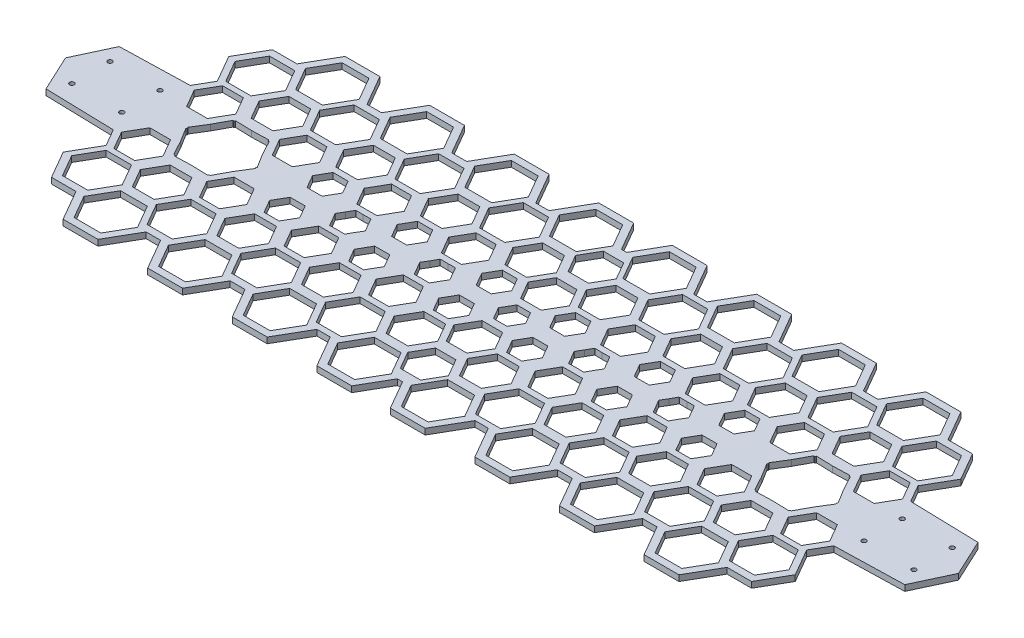
from build123d import *

# Parameters (mm, degrees)
SKETCH2_W                    = 965.2
SKETCH2_H                    = 304.8
BOSS_EXTRUDE1_DEPTH          = 6.35
CUT_EXTRUDE3_DEPTH           = 507.13125027
CUT_EXTRUDE4_DEPTH           = 507.13125027
CUT_EXTRUDE5_DEPTH           = 507.13125027
MIRROR11_COPY_1_DEPTH        = 507.13125027
MIRROR11_COPY_2_DEPTH        = 507.13125027
MIRROR11_COPY_3_DEPTH        = 507.13125027
MIRROR11_COPY_4_DEPTH        = 507.13125027
F_10_0_1935_DIAMETER_HOLE2_D = 4.9149


with BuildPart() as part:
    # Sketch2 → Boss-Extrude1 (new body)
    with BuildSketch(Plane(origin=(0, 0, 0), x_dir=(1, 0, 0), z_dir=(0, 1, 0))):
        Rectangle(SKETCH2_W, SKETCH2_H)
    extrude(amount=BOSS_EXTRUDE1_DEPTH)

    # Sketch7 → Cut-Extrude3 (cut, through all)
    with BuildSketch(Plane(origin=(0, 6.35, 0), x_dir=(1, 0, 0), z_dir=(0, 1, 0))):
        Polygon((-31.557733394, 37.30423334), (-47.833152431, 37.30423334), (-55.970861949, 23.209306996), (-47.833152431, 9.114380653), (-31.557733394, 9.114380653), (-23.420023875, 23.209306996), align=None)
        Polygon((-16.10013485, 64.205726722), (-27.897788881, 84.639862914), (-51.493096943, 84.639862914), (-63.290750974, 64.205726722), (-51.493096943, 43.77159053), (-27.897788881, 43.77159053), align=None)
        Polygon((-10.698063798, 119.777667092), (-25.196753355, 144.890134049), (-54.19413247, 144.890134049), (-68.692822027, 119.777667092), (-54.19413247, 94.665200136), (-25.196753355, 94.665200136), align=None)
        Polygon((-64.407710667, 39.328268759), (-75.230438627, 58.073783461), (-96.875894546, 58.073783461), (-107.698622506, 39.328268759), (-96.875894546, 20.582754056), (-75.230438627, 20.582754056), align=None)
        Polygon((-58.745423058, 88.260379231), (-72.399294822, 111.909578847), (-99.707038351, 111.909578847), (-113.360910116, 88.260379231), (-99.707038351, 64.611179615), (-72.399294822, 64.611179615), align=None)
        Polygon((-122.997733394, 37.30423334), (-139.273152431, 37.30423334), (-147.410861949, 23.209306996), (-139.273152431, 9.114380653), (-122.997733394, 9.114380653), (-114.860023875, 23.209306996), align=None)
        Polygon((-67.212185048, 0.237167397), (-75.528357755, 14.166866255), (-91.749917187, 13.929698858), (-99.655303911, -0.237167397), (-91.339131205, -14.166866255), (-75.117571773, -13.929698858), align=None)
        Polygon((-107.54013485, 64.205726722), (-119.337788881, 84.639862914), (-142.933096943, 84.639862914), (-154.730750974, 64.205726722), (-142.933096943, 43.77159053), (-119.337788881, 43.77159053), align=None)
        Polygon((-102.138063798, 119.777667092), (-116.636753355, 144.890134049), (-145.63413247, 144.890134049), (-160.132822027, 119.777667092), (-145.63413247, 94.665200136), (-116.636753355, 94.665200136), align=None)
        Polygon((-155.847710667, 39.328268759), (-166.670438627, 58.073783461), (-188.315894546, 58.073783461), (-199.138622506, 39.328268759), (-188.315894546, 20.582754056), (-166.670438627, 20.582754056), align=None)
        Polygon((-150.185423058, 88.260379231), (-163.839294822, 111.909578847), (-191.147038351, 111.909578847), (-204.800910116, 88.260379231), (-191.147038351, 64.611179615), (-163.839294822, 64.611179615), align=None)
        Polygon((-158.652185048, 0.237167397), (-166.968357755, 14.166866255), (-183.189917187, 13.929698858), (-191.095303911, -0.237167397), (-182.779131205, -14.166866255), (-166.557571773, -13.929698858), align=None)
        Polygon((-214.437733394, 37.30423334), (-230.713152431, 37.30423334), (-238.850861949, 23.209306996), (-230.713152431, 9.114380653), (-214.437733394, 9.114380653), (-206.300023875, 23.209306996), align=None)
        Polygon((-198.98013485, 64.205726722), (-210.777788881, 84.639862914), (-234.373096943, 84.639862914), (-246.170750974, 64.205726722), (-234.373096943, 43.77159053), (-210.777788881, 43.77159053), align=None)
        Polygon((-193.578063797, 119.777667092), (-208.076753355, 144.890134049), (-237.074132469, 144.890134049), (-251.572822027, 119.777667092), (-237.074132469, 94.665200136), (-208.076753355, 94.665200136), align=None)
        Polygon((-247.287710667, 39.328268759), (-258.110438627, 58.073783461), (-279.755894546, 58.073783461), (-290.578622506, 39.328268759), (-279.755894546, 20.582754056), (-258.110438627, 20.582754056), align=None)
        Polygon((-241.625423058, 88.260379231), (-255.279294822, 111.909578847), (-282.587038351, 111.909578847), (-296.240910116, 88.260379231), (-282.587038351, 64.611179615), (-255.279294822, 64.611179615), align=None)
        Polygon((-290.42013485, 64.205726722), (-302.217788881, 84.639862914), (-325.813096943, 84.639862914), (-337.610750974, 64.205726722), (-325.813096943, 43.77159053), (-302.217788881, 43.77159053), align=None)
        Polygon((-285.018063797, 119.777667092), (-299.516753355, 144.890134049), (-328.514132469, 144.890134049), (-343.012822027, 119.777667092), (-328.514132469, 94.665200136), (-299.516753355, 94.665200136), align=None)
        Polygon((-333.065423058, 88.260379231), (-346.719294822, 111.909578847), (-374.027038351, 111.909578847), (-387.680910115, 88.260379231), (-374.027038351, 64.611179615), (-346.719294822, 64.611179615), align=None)
        Polygon((-296.240910116, 33.030081091), (-333.733065828, 31.908237488), (-351.507598624, -1.121843603), (-331.789975709, -33.030081091), (-294.297819997, -31.908237488), (-276.5232872, 1.121843603), align=None)
        Polygon((-337.92047672, 39.328268759), (-349.146821653, 58.772868567), (-371.59951152, 58.772868567), (-382.825856454, 39.328268759), (-371.59951152, 19.883668951), (-349.146821653, 19.883668951), align=None)
    cut_extrude3 = extrude(amount=-CUT_EXTRUDE3_DEPTH, mode=Mode.SUBTRACT)

    # Sketch8 → Cut-Extrude4 (cut, through all)
    with BuildSketch(Plane(origin=(0, 6.35, 0), x_dir=(1, 0, 0), z_dir=(0, 1, 0))):
        Polygon((10.994488416, 109.737813004), (-10.994488416, 109.737813004), (-21.988976832, 90.694800464), (-10.994488416, 71.651787924), (10.994488416, 71.651787924), (21.988976832, 90.694800464), align=None)
        Polygon((10.728851511, 59.450017641), (-11.556453484, 59.450017641), (-22.699105982, 40.150377383), (-11.556453484, 20.850737126), (10.728851511, 20.850737126), (21.871504009, 40.150377383), align=None)
        Polygon((7.342001122, 12.716718973), (-7.342001122, 12.716718973), (-14.684002245, 0), (-7.342001122, -12.716718973), (7.342001122, -12.716718973), (14.684002245, 0), align=None)
    cut_extrude4 = extrude(amount=-CUT_EXTRUDE4_DEPTH, mode=Mode.SUBTRACT)

    # Sketch3 → Cut-Extrude5 (cut, through all)
    with BuildSketch(Plane(origin=(0, 6.35, 0), x_dir=(1, 0, 0), z_dir=(0, 1, 0))):
        Polygon((-482.6, 0), (-464.142167298, 39.582949968), (-389.400254125, 41.562639655), (-378.695532412, 60.103761542), (-395.652159794, 89.473501691), (-378.36286148, 119.419444799), (-351.891288022, 119.419444799), (-332.849955598, 152.4), (-295.180930226, 152.4), (-276.139597803, 119.419444799), (-260.451288022, 119.419444799), (-241.409955598, 152.4), (-203.740930226, 152.4), (-184.90641754, 119.777667092), (-168.804468284, 119.777667092), (-149.969955598, 152.4), (-112.300930226, 152.4), (-92.579101272, 118.240790232), (-78.251784553, 118.240790232), (-58.529955598, 152.4), (-20.860930226, 152.4), (-2.823570321, 121.158376209), (0, 121.158376209), (0, 240.353310545), (-11.734407676, 240.353310545), (-689.383609758, 240.353310545), (-689.383609758, 0), align=None)
    cut_extrude5 = extrude(amount=-CUT_EXTRUDE5_DEPTH, mode=Mode.SUBTRACT)

    # Mirror10: Cut-Extrude3, Cut-Extrude5 across plane
    add(cut_extrude3.mirror(Plane(origin=(0, 0, 0), x_dir=(0, 0, 1), z_dir=(1, 0, 0))), mode=Mode.SUBTRACT)
    add(cut_extrude5.mirror(Plane(origin=(0, 0, 0), x_dir=(0, 0, 1), z_dir=(1, 0, 0))), mode=Mode.SUBTRACT)

    # Mirror11: Cut-Extrude4 across plane
    add(cut_extrude4.mirror(Plane.XY), mode=Mode.SUBTRACT)

    # Mirror11 copy 1 sketch → Mirror11 copy 1 (cut, through all)
    with BuildSketch(Plane(origin=(0, 6.35, 0), x_dir=(-1, 0, 0), z_dir=(0, 1, 0))):
        Polygon((-31.557733394, 37.30423334), (-47.833152431, 37.30423334), (-55.970861949, 23.209306996), (-47.833152431, 9.114380653), (-31.557733394, 9.114380653), (-23.420023875, 23.209306996), align=None)
        Polygon((-16.10013485, 64.205726722), (-27.897788881, 84.639862914), (-51.493096943, 84.639862914), (-63.290750974, 64.205726722), (-51.493096943, 43.77159053), (-27.897788881, 43.77159053), align=None)
        Polygon((-10.698063798, 119.777667092), (-25.196753355, 144.890134049), (-54.19413247, 144.890134049), (-68.692822027, 119.777667092), (-54.19413247, 94.665200136), (-25.196753355, 94.665200136), align=None)
        Polygon((-64.407710667, 39.328268759), (-75.230438627, 58.073783461), (-96.875894546, 58.073783461), (-107.698622506, 39.328268759), (-96.875894546, 20.582754056), (-75.230438627, 20.582754056), align=None)
        Polygon((-58.745423058, 88.260379231), (-72.399294822, 111.909578847), (-99.707038351, 111.909578847), (-113.360910116, 88.260379231), (-99.707038351, 64.611179615), (-72.399294822, 64.611179615), align=None)
        Polygon((-122.997733394, 37.30423334), (-139.273152431, 37.30423334), (-147.410861949, 23.209306996), (-139.273152431, 9.114380653), (-122.997733394, 9.114380653), (-114.860023875, 23.209306996), align=None)
        Polygon((-67.212185048, 0.237167397), (-75.528357755, 14.166866255), (-91.749917187, 13.929698858), (-99.655303911, -0.237167397), (-91.339131205, -14.166866255), (-75.117571773, -13.929698858), align=None)
        Polygon((-107.54013485, 64.205726722), (-119.337788881, 84.639862914), (-142.933096943, 84.639862914), (-154.730750974, 64.205726722), (-142.933096943, 43.77159053), (-119.337788881, 43.77159053), align=None)
        Polygon((-102.138063798, 119.777667092), (-116.636753355, 144.890134049), (-145.63413247, 144.890134049), (-160.132822027, 119.777667092), (-145.63413247, 94.665200136), (-116.636753355, 94.665200136), align=None)
        Polygon((-155.847710667, 39.328268759), (-166.670438627, 58.073783461), (-188.315894546, 58.073783461), (-199.138622506, 39.328268759), (-188.315894546, 20.582754056), (-166.670438627, 20.582754056), align=None)
        Polygon((-150.185423058, 88.260379231), (-163.839294822, 111.909578847), (-191.147038351, 111.909578847), (-204.800910116, 88.260379231), (-191.147038351, 64.611179615), (-163.839294822, 64.611179615), align=None)
        Polygon((-158.652185048, 0.237167397), (-166.968357755, 14.166866255), (-183.189917187, 13.929698858), (-191.095303911, -0.237167397), (-182.779131205, -14.166866255), (-166.557571773, -13.929698858), align=None)
        Polygon((-214.437733394, 37.30423334), (-230.713152431, 37.30423334), (-238.850861949, 23.209306996), (-230.713152431, 9.114380653), (-214.437733394, 9.114380653), (-206.300023875, 23.209306996), align=None)
        Polygon((-198.98013485, 64.205726722), (-210.777788881, 84.639862914), (-234.373096943, 84.639862914), (-246.170750974, 64.205726722), (-234.373096943, 43.77159053), (-210.777788881, 43.77159053), align=None)
        Polygon((-193.578063797, 119.777667092), (-208.076753355, 144.890134049), (-237.074132469, 144.890134049), (-251.572822027, 119.777667092), (-237.074132469, 94.665200136), (-208.076753355, 94.665200136), align=None)
        Polygon((-247.287710667, 39.328268759), (-258.110438627, 58.073783461), (-279.755894546, 58.073783461), (-290.578622506, 39.328268759), (-279.755894546, 20.582754056), (-258.110438627, 20.582754056), align=None)
        Polygon((-241.625423058, 88.260379231), (-255.279294822, 111.909578847), (-282.587038351, 111.909578847), (-296.240910116, 88.260379231), (-282.587038351, 64.611179615), (-255.279294822, 64.611179615), align=None)
        Polygon((-290.42013485, 64.205726722), (-302.217788881, 84.639862914), (-325.813096943, 84.639862914), (-337.610750974, 64.205726722), (-325.813096943, 43.77159053), (-302.217788881, 43.77159053), align=None)
        Polygon((-285.018063797, 119.777667092), (-299.516753355, 144.890134049), (-328.514132469, 144.890134049), (-343.012822027, 119.777667092), (-328.514132469, 94.665200136), (-299.516753355, 94.665200136), align=None)
        Polygon((-333.065423058, 88.260379231), (-346.719294822, 111.909578847), (-374.027038351, 111.909578847), (-387.680910115, 88.260379231), (-374.027038351, 64.611179615), (-346.719294822, 64.611179615), align=None)
        Polygon((-296.240910116, 33.030081091), (-333.733065828, 31.908237488), (-351.507598624, -1.121843603), (-331.789975709, -33.030081091), (-294.297819997, -31.908237488), (-276.5232872, 1.121843603), align=None)
        Polygon((-337.92047672, 39.328268759), (-349.146821653, 58.772868567), (-371.59951152, 58.772868567), (-382.825856454, 39.328268759), (-371.59951152, 19.883668951), (-349.146821653, 19.883668951), align=None)
    extrude(amount=-MIRROR11_COPY_1_DEPTH, mode=Mode.SUBTRACT)

    # Mirror11 copy 2 sketch → Mirror11 copy 2 (cut, through all)
    with BuildSketch(Plane(origin=(0, 6.35, 0), x_dir=(-1, 0, 0), z_dir=(0, 1, 0))):
        Polygon((-482.6, 0), (-464.142167298, 39.582949968), (-389.400254125, 41.562639655), (-378.695532412, 60.103761542), (-395.652159794, 89.473501691), (-378.36286148, 119.419444799), (-351.891288022, 119.419444799), (-332.849955598, 152.4), (-295.180930226, 152.4), (-276.139597803, 119.419444799), (-260.451288022, 119.419444799), (-241.409955598, 152.4), (-203.740930226, 152.4), (-184.90641754, 119.777667092), (-168.804468284, 119.777667092), (-149.969955598, 152.4), (-112.300930226, 152.4), (-92.579101272, 118.240790232), (-78.251784553, 118.240790232), (-58.529955598, 152.4), (-20.860930226, 152.4), (-2.823570321, 121.158376209), (0, 121.158376209), (0, 240.353310545), (-11.734407676, 240.353310545), (-689.383609758, 240.353310545), (-689.383609758, 0), align=None)
    extrude(amount=-MIRROR11_COPY_2_DEPTH, mode=Mode.SUBTRACT)

    # Mirror11 copy 3 sketch → Mirror11 copy 3 (cut, through all)
    with BuildSketch(Plane(origin=(0, 6.35, 0), x_dir=(1, 0, 0), z_dir=(0, 1, 0))):
        Polygon((-31.557733394, -37.30423334), (-47.833152431, -37.30423334), (-55.970861949, -23.209306996), (-47.833152431, -9.114380653), (-31.557733394, -9.114380653), (-23.420023875, -23.209306996), align=None)
        Polygon((-16.10013485, -64.205726722), (-27.897788881, -84.639862914), (-51.493096943, -84.639862914), (-63.290750974, -64.205726722), (-51.493096943, -43.77159053), (-27.897788881, -43.77159053), align=None)
        Polygon((-10.698063798, -119.777667092), (-25.196753355, -144.890134049), (-54.19413247, -144.890134049), (-68.692822027, -119.777667092), (-54.19413247, -94.665200136), (-25.196753355, -94.665200136), align=None)
        Polygon((-64.407710667, -39.328268759), (-75.230438627, -58.073783461), (-96.875894546, -58.073783461), (-107.698622506, -39.328268759), (-96.875894546, -20.582754056), (-75.230438627, -20.582754056), align=None)
        Polygon((-58.745423058, -88.260379231), (-72.399294822, -111.909578847), (-99.707038351, -111.909578847), (-113.360910116, -88.260379231), (-99.707038351, -64.611179615), (-72.399294822, -64.611179615), align=None)
        Polygon((-122.997733394, -37.30423334), (-139.273152431, -37.30423334), (-147.410861949, -23.209306996), (-139.273152431, -9.114380653), (-122.997733394, -9.114380653), (-114.860023875, -23.209306996), align=None)
        Polygon((-67.212185048, -0.237167397), (-75.528357755, -14.166866255), (-91.749917187, -13.929698858), (-99.655303911, 0.237167397), (-91.339131205, 14.166866255), (-75.117571773, 13.929698858), align=None)
        Polygon((-107.54013485, -64.205726722), (-119.337788881, -84.639862914), (-142.933096943, -84.639862914), (-154.730750974, -64.205726722), (-142.933096943, -43.77159053), (-119.337788881, -43.77159053), align=None)
        Polygon((-102.138063798, -119.777667092), (-116.636753355, -144.890134049), (-145.63413247, -144.890134049), (-160.132822027, -119.777667092), (-145.63413247, -94.665200136), (-116.636753355, -94.665200136), align=None)
        Polygon((-155.847710667, -39.328268759), (-166.670438627, -58.073783461), (-188.315894546, -58.073783461), (-199.138622506, -39.328268759), (-188.315894546, -20.582754056), (-166.670438627, -20.582754056), align=None)
        Polygon((-150.185423058, -88.260379231), (-163.839294822, -111.909578847), (-191.147038351, -111.909578847), (-204.800910116, -88.260379231), (-191.147038351, -64.611179615), (-163.839294822, -64.611179615), align=None)
        Polygon((-158.652185048, -0.237167397), (-166.968357755, -14.166866255), (-183.189917187, -13.929698858), (-191.095303911, 0.237167397), (-182.779131205, 14.166866255), (-166.557571773, 13.929698858), align=None)
        Polygon((-214.437733394, -37.30423334), (-230.713152431, -37.30423334), (-238.850861949, -23.209306996), (-230.713152431, -9.114380653), (-214.437733394, -9.114380653), (-206.300023875, -23.209306996), align=None)
        Polygon((-198.98013485, -64.205726722), (-210.777788881, -84.639862914), (-234.373096943, -84.639862914), (-246.170750974, -64.205726722), (-234.373096943, -43.77159053), (-210.777788881, -43.77159053), align=None)
        Polygon((-193.578063797, -119.777667092), (-208.076753355, -144.890134049), (-237.074132469, -144.890134049), (-251.572822027, -119.777667092), (-237.074132469, -94.665200136), (-208.076753355, -94.665200136), align=None)
        Polygon((-247.287710667, -39.328268759), (-258.110438627, -58.073783461), (-279.755894546, -58.073783461), (-290.578622506, -39.328268759), (-279.755894546, -20.582754056), (-258.110438627, -20.582754056), align=None)
        Polygon((-241.625423058, -88.260379231), (-255.279294822, -111.909578847), (-282.587038351, -111.909578847), (-296.240910116, -88.260379231), (-282.587038351, -64.611179615), (-255.279294822, -64.611179615), align=None)
        Polygon((-290.42013485, -64.205726722), (-302.217788881, -84.639862914), (-325.813096943, -84.639862914), (-337.610750974, -64.205726722), (-325.813096943, -43.77159053), (-302.217788881, -43.77159053), align=None)
        Polygon((-285.018063797, -119.777667092), (-299.516753355, -144.890134049), (-328.514132469, -144.890134049), (-343.012822027, -119.777667092), (-328.514132469, -94.665200136), (-299.516753355, -94.665200136), align=None)
        Polygon((-333.065423058, -88.260379231), (-346.719294822, -111.909578847), (-374.027038351, -111.909578847), (-387.680910115, -88.260379231), (-374.027038351, -64.611179615), (-346.719294822, -64.611179615), align=None)
        Polygon((-296.240910116, -33.030081091), (-333.733065828, -31.908237488), (-351.507598624, 1.121843603), (-331.789975709, 33.030081091), (-294.297819997, 31.908237488), (-276.5232872, -1.121843603), align=None)
        Polygon((-337.92047672, -39.328268759), (-349.146821653, -58.772868567), (-371.59951152, -58.772868567), (-382.825856454, -39.328268759), (-371.59951152, -19.883668951), (-349.146821653, -19.883668951), align=None)
    extrude(amount=-MIRROR11_COPY_3_DEPTH, mode=Mode.SUBTRACT)

    # Mirror11 copy 4 sketch → Mirror11 copy 4 (cut, through all)
    with BuildSketch(Plane(origin=(0, 6.35, 0), x_dir=(1, 0, 0), z_dir=(0, 1, 0))):
        Polygon((-482.6, 0), (-464.142167298, -39.582949968), (-389.400254125, -41.562639655), (-378.695532412, -60.103761542), (-395.652159794, -89.473501691), (-378.36286148, -119.419444799), (-351.891288022, -119.419444799), (-332.849955598, -152.4), (-295.180930226, -152.4), (-276.139597803, -119.419444799), (-260.451288022, -119.419444799), (-241.409955598, -152.4), (-203.740930226, -152.4), (-184.90641754, -119.777667092), (-168.804468284, -119.777667092), (-149.969955598, -152.4), (-112.300930226, -152.4), (-92.579101272, -118.240790232), (-78.251784553, -118.240790232), (-58.529955598, -152.4), (-20.860930226, -152.4), (-2.823570321, -121.158376209), (0, -121.158376209), (0, -240.353310545), (-11.734407676, -240.353310545), (-689.383609758, -240.353310545), (-689.383609758, 0), align=None)
    extrude(amount=-MIRROR11_COPY_4_DEPTH, mode=Mode.SUBTRACT)

    # #10 (0.1935) Diameter Hole2 (through all)
    with Locations(Plane(origin=(0, 6.35, 0), x_dir=(1, 0, 0), z_dir=(0, 1, 0))):
        with Locations((-401.152408866, -20.6375), (-455.127408866, 20.6375), (-455.127408866, -20.6375), (-401.152408866, 20.6375)):
            f_10_0_1935_diameter_hole2 = Hole(F_10_0_1935_DIAMETER_HOLE2_D / 2)

    # Mirror12: #10 (0.1935) Diameter Hole2 across plane
    add(f_10_0_1935_diameter_hole2.mirror(Plane(origin=(0, 0, 0), x_dir=(0, 0, 1), z_dir=(1, 0, 0))), mode=Mode.SUBTRACT)


solid = part.part
